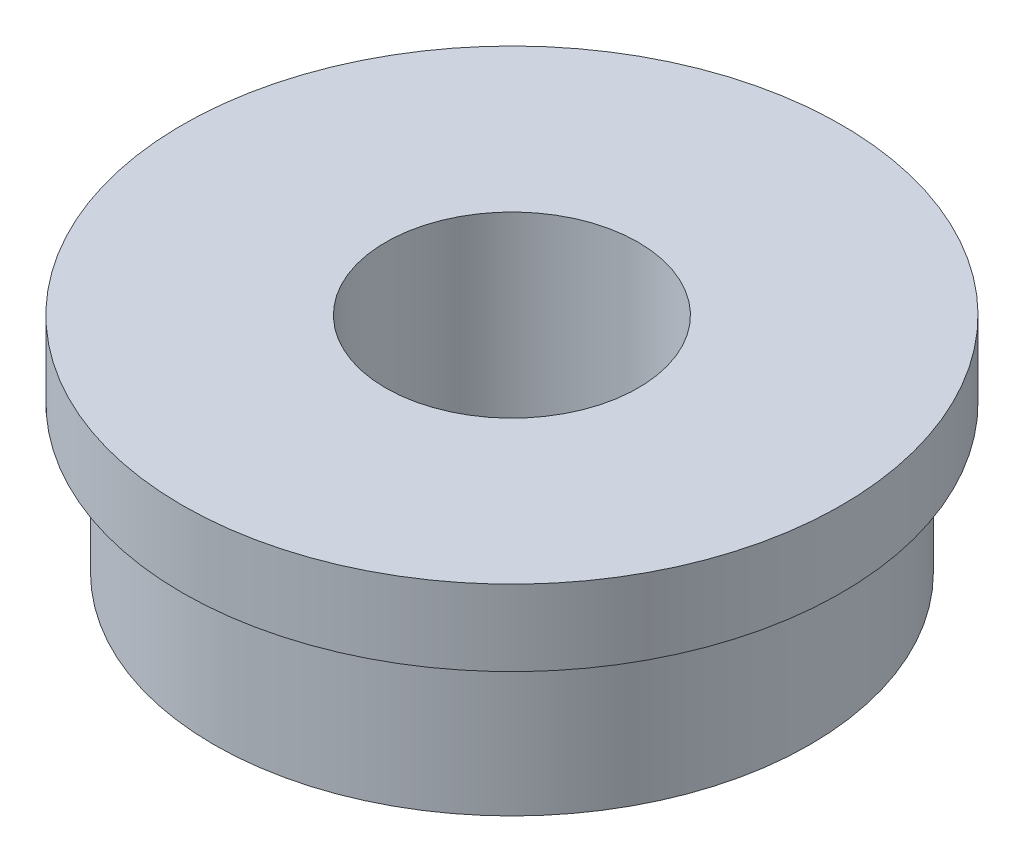
from build123d import *

# Parameters (mm, degrees)
SKETCH2_R                = 11.1125
BOSS_EXTRUDE1_DEPTH      = 7.14375
SKETCH3_R                = 12.303125
BOSS_EXTRUDE2_DEPTH      = 1.5875
CUT_EXTRUDE2_DEPTH       = 19.808693033
CUT_EXTRUDE2_DEPTH_BACK  = 19.808693033
SKETCH4_R                = 4.7625
MOVE_FACE1_BY            = 1.27
MOVE_FACE1_2_BY          = 1.27
MOVE_START               = -1.27
MOVE_FACE2_OUTLINE_R     = 11.2395
MOVE_FACE2_OUTLINE_R_2   = 11.1125
MOVE_FACE2_DEPTH         = 5.55625
MOVE_START_2             = 4.28625
MOVE_FACE2_2_OUTLINE_R   = 12.430125
MOVE_FACE2_2_OUTLINE_R_2 = 12.303125
MOVE_FACE2_2_DEPTH       = 2.8575
CHAMFER1_SIZE            = 0.396875


# Read off the part's stored shape, not the designer's step: Move Face2
with BuildPart() as part:
    # Sketch2 → Boss-Extrude1 (new body)
    with BuildSketch(Plane(origin=(0, 0, 0), x_dir=(1, 0, 0), z_dir=(0, 1, 0))):
        with Locations(Location((0, 0, 0), (0, 0, 270))):
            Circle(SKETCH2_R)
    extrude(amount=BOSS_EXTRUDE1_DEPTH)

    # Sketch3 → Boss-Extrude2 (add)
    with BuildSketch(Plane(origin=(0, 7.14375, 0), x_dir=(1, 0, 0), z_dir=(0, 1, 0))):
        with Locations(Location((0, 0, 0), (0, 0, 270))):
            Circle(SKETCH3_R)
    extrude(amount=-BOSS_EXTRUDE2_DEPTH)

    # Sketch4 → Cut-Extrude2 (cut, two sides: drawn at the far end of the back side and taken through both)
    with BuildSketch(Plane(origin=(0, 0, 0), x_dir=(1, 0, 0), z_dir=(0, 1, 0)).offset(-CUT_EXTRUDE2_DEPTH_BACK)):
        with Locations(Location((0, 0, 0), (0, 0, 270))):
            Circle(SKETCH4_R)
    extrude(amount=CUT_EXTRUDE2_DEPTH + CUT_EXTRUDE2_DEPTH_BACK, mode=Mode.SUBTRACT)

    # Move Face1: a face moved outward by 1.27
    extrude(part.faces().sort_by_distance((-6.1515625, 5.55625, 9.8425))[0], amount=MOVE_FACE1_BY, dir=(0, -1, 0))

    # Move Face1 2: a face moved outward by 1.27
    extrude(part.faces().sort_by_distance((0, 0, 5.55625))[0], amount=MOVE_FACE1_2_BY, dir=(0, -1, 0))

    # Move Face2 outline → Move Face2 (add)
    with BuildSketch(Plane(origin=(0, 0, 0), x_dir=(1, 0, 0), z_dir=(0, 1, 0)).offset(MOVE_START)):
        Circle(MOVE_FACE2_OUTLINE_R)
        Circle(MOVE_FACE2_OUTLINE_R_2, mode=Mode.SUBTRACT)
    extrude(amount=MOVE_FACE2_DEPTH)

    # Move Face2 2 outline → Move Face2 2 (add)
    with BuildSketch(Plane(origin=(0, 0, 0), x_dir=(1, 0, 0), z_dir=(0, 1, 0)).offset(MOVE_START_2)):
        Circle(MOVE_FACE2_2_OUTLINE_R)
        Circle(MOVE_FACE2_2_OUTLINE_R_2, mode=Mode.SUBTRACT)
    extrude(amount=MOVE_FACE2_2_DEPTH)

    # Chamfer1
    chamfer1_edges = [part.edges().sort_by_distance(p)[0] for p in [
        (-11.2395, 4.28625, 0),
    ]]
    chamfer(chamfer1_edges, length=CHAMFER1_SIZE)


solid = part.part
